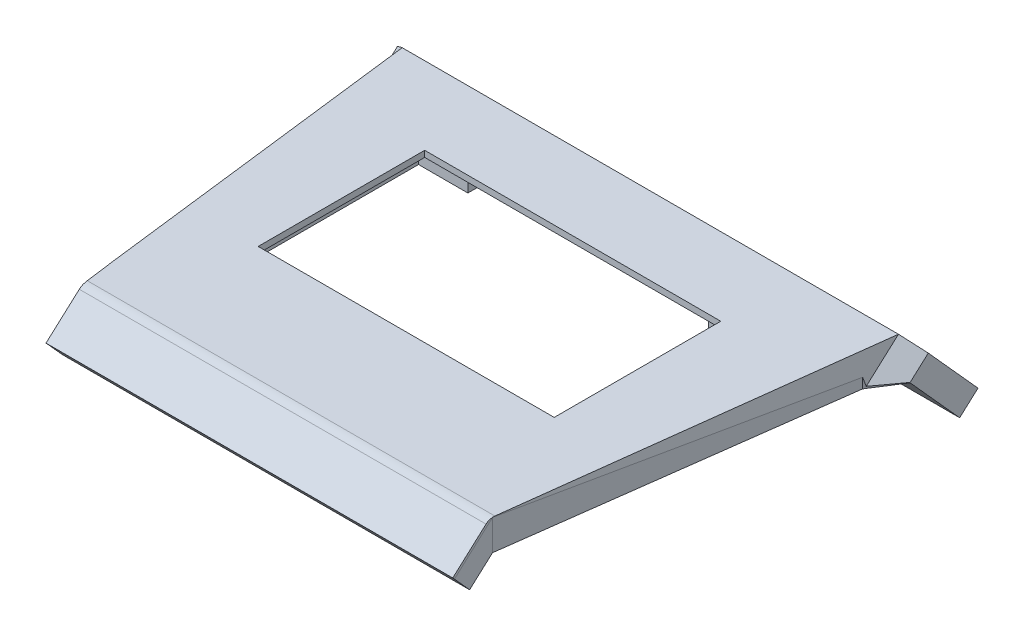
from build123d import *

# Parameters (mm, degrees)
SKETCH1_W                = 27.5
SKETCH1_H                = 19.5
BOSS_EXTRUDE1_DEPTH      = 2.5
BOSS_EXTRUDE2_DEPTH      = 16.5
BOSS_EXTRUDE2_DEPTH_BACK = 16.5
BOSS_EXTRUDE3_DEPTH      = 21.5
BOSS_EXTRUDE3_DEPTH_BACK = 21.25
CUT_EXTRUDE1_DEPTH       = 37.936693725
SKETCH5_R                = 1.75
CUT_EXTRUDE2_DEPTH       = 37.936693725
CHAMFER1_SIZE            = 5.494954839
CHAMFER1_SIZE_2          = 2
BOSS_EXTRUDE4_REACH      = 31.601
SKETCH6_W                = 6
SKETCH6_H                = 4.75
SKETCH7_W                = 19.5
SKETCH7_H                = 4
CUT_EXTRUDE3_DEPTH       = 2
SKETCH8_W                = 27.5
SKETCH8_H                = 19.5
SKETCH8_W_2              = 24
SKETCH8_H_2              = 13.5
BOSS_EXTRUDE5_DEPTH      = 0.5
FILLET1_R                = 1


with BuildPart() as part:
    # Sketch1 → Boss-Extrude1 (new body)
    with BuildSketch(Plane(origin=(0, 0, 0), x_dir=(1, 0, 0), z_dir=(0, 1, 0))):
        Polygon((-16.5, -14.5), (16.5, -14.5), (20, 12), (21.5, 14.35), (-21.25, 14.35), (-20, 12), align=None)
        Rectangle(SKETCH1_W, SKETCH1_H, mode=Mode.SUBTRACT)
    extrude(amount=BOSS_EXTRUDE1_DEPTH)

    # Sketch2 → Boss-Extrude2 (add, two sides: drawn at the far end of the back side and taken through both)
    with BuildSketch(Plane(origin=(0, 0, 0), x_dir=(0, 0, -1), z_dir=(1, 0, 0)).offset(-BOSS_EXTRUDE2_DEPTH_BACK)):
        Polygon((-14.5, 0), (-16.357862064, -1.672826516), (-17.696123276, -0.186536865), (-14.712421813, 2.5), (-14.5, 2.5), align=None)
    extrude(amount=BOSS_EXTRUDE2_DEPTH + BOSS_EXTRUDE2_DEPTH_BACK)

    # Sketch3 → Boss-Extrude3 (add, two sides: drawn at the far end of the back side and taken through both)
    with BuildSketch(Plane(origin=(0, 0, 0), x_dir=(0, 0, -1), z_dir=(1, 0, 0)).offset(-BOSS_EXTRUDE3_DEPTH_BACK)):
        Polygon((14.35, 2.5), (14.790255348, 2.5), (19.851073289, -3.12060774), (18.364783638, -4.458868953), (14.35, 0), align=None)
    extrude(amount=BOSS_EXTRUDE3_DEPTH + BOSS_EXTRUDE3_DEPTH_BACK)

    # Sketch4 → Cut-Extrude1 (cut, through all)
    with BuildSketch(Plane(origin=(0, 8.473955812, -9.411281375), x_dir=(-1, 0, 0), z_dir=(0, 0.6691306063588619, -0.7431448254773909))):
        Polygon((-20.113700783, -8.038750466), (-16.458708787, 11.769448481), (-23.724996003, 11.769448481), (-23.724996003, -12.049500132), align=None)
        Polygon((20.113700783, -8.038750466), (24.708588094, -12.633637777), (20.852277712, 11.769448481), (16.5, 11.702393792), align=None)
    extrude(amount=-CUT_EXTRUDE1_DEPTH, mode=Mode.SUBTRACT)

    # Sketch5 → Cut-Extrude2 (cut, through all)
    with BuildSketch(Plane(origin=(0, 8.473955812, -9.411281375), x_dir=(-1, 0, 0), z_dir=(0, 0.6691306063588619, -0.7431448254773909))):
        with Locations(Location((-17, -12.352024201, 0), (0, 0, 90))):
            Circle(SKETCH5_R)
        with Locations(Location((17, -12.352024201, 0), (0, 0, 90))):
            Circle(SKETCH5_R)
    extrude(amount=-CUT_EXTRUDE2_DEPTH, mode=Mode.SUBTRACT)

    # Chamfer1
    # the kernel refuses this chamfer: 5.494954839, 2 mm, written as the material it takes off along each edge
    with BuildSketch(Plane(origin=(13.75, 0, 9.75), x_dir=(0, -0.013184058198645777, 0.9999130865277316), z_dir=(-1, 0, 0))) as chamfer1_piece_1_section:
        Polygon((CHAMFER1_SIZE * 0.999913086511, CHAMFER1_SIZE * 0.0131840581984), (-CHAMFER1_SIZE_2 * 0.0131840581986, CHAMFER1_SIZE_2 * 0.999913086528), (0, 0), align=None)
    chamfer1_piece_1 = extrude(amount=27.5, mode=Mode.PRIVATE)
    chamfer1_piece_1 = split(chamfer1_piece_1, bisect_by=Plane(origin=(0, 1.804468024, 12.49593523), z_dir=(0, -0.7431448254773978, -0.6691306063588544)), keep=Keep.TOP, mode=Mode.PRIVATE)
    add(chamfer1_piece_1, mode=Mode.SUBTRACT)

    # Boss-Extrude4: up to this plane
    boss_extrude4_end = Plane(origin=(0, 0, 15.244954839), z_dir=(0, -0.9396926207859098, -0.3420201433256651))
    # Sketch6 → Boss-Extrude4 (add, up to the surface)
    with BuildSketch(Plane.XZ, mode=Mode.PRIVATE) as boss_extrude4_sk1:
        with Locations((-10.75, 12.125)):
            Rectangle(SKETCH6_W, SKETCH6_H)
    boss_extrude4_tool1 = split(extrude(boss_extrude4_sk1.sketch, amount=-BOSS_EXTRUDE4_REACH, mode=Mode.PRIVATE), bisect_by=boss_extrude4_end, keep=Keep.BOTH, mode=Mode.PRIVATE)
    add(boss_extrude4_tool1.solids().sort_by_distance((-10.75, 0, 12.125))[0])
    # Sketch6 → Boss-Extrude4 (add, up to the surface)
    with BuildSketch(Plane.XZ, mode=Mode.PRIVATE) as boss_extrude4_sk2:
        with Locations((10.75, 12.125)):
            Rectangle(SKETCH6_W, SKETCH6_H)
    boss_extrude4_tool2 = split(extrude(boss_extrude4_sk2.sketch, amount=-BOSS_EXTRUDE4_REACH, mode=Mode.PRIVATE), bisect_by=boss_extrude4_end, keep=Keep.BOTH, mode=Mode.PRIVATE)
    add(boss_extrude4_tool2.solids().sort_by_distance((10.75, 0, 12.125))[0])

    # Sketch7 → Cut-Extrude3 (cut)
    with BuildSketch(Plane.XZ):
        with Locations((0, -11.75)):
            Rectangle(SKETCH7_W, SKETCH7_H)
    extrude(amount=-CUT_EXTRUDE3_DEPTH, mode=Mode.SUBTRACT)

    # Sketch8 → Boss-Extrude5 (add)
    with BuildSketch(Plane(origin=(0, 2.5, 0), x_dir=(1, 0, 0), z_dir=(0, 1, 0))):
        Rectangle(SKETCH8_W, SKETCH8_H)
        with Locations((0, 1.75)):
            Rectangle(SKETCH8_W_2, SKETCH8_H_2, mode=Mode.SUBTRACT)
    extrude(amount=-BOSS_EXTRUDE5_DEPTH)

    # Fillet1
    fillet1_edges = [part.edges().sort_by_distance(p)[0] for p in [
        (-0.01445917, 2.5, 14.712421813),
    ]]
    fillet(fillet1_edges, radius=FILLET1_R)


solid = part.part
